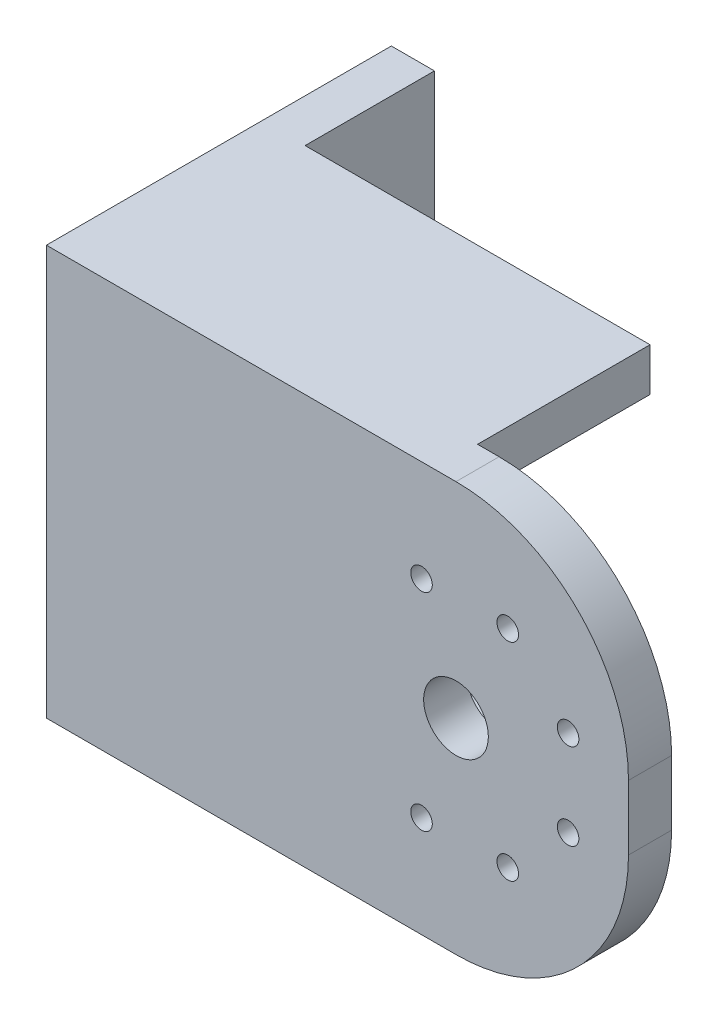
from build123d import *

# Parameters (mm, degrees)
SKETCH3_R           = 7.5
SKETCH3_R_2         = 2.5
BOSS_EXTRUDE1_DEPTH = 10
SKETCH4_W           = 10
SKETCH4_H           = 95
BOSS_EXTRUDE2_DEPTH = 70
SKETCH5_W           = 80
SKETCH5_H           = 10
BOSS_EXTRUDE3_DEPTH = 40
SKETCH6_W           = 32
SKETCH6_H           = 36
CUT_EXTRUDE1_DEPTH  = 43.8
SKETCH8_R           = 7.5
SKETCH8_R_2         = 2.5
CUT_EXTRUDE2_DEPTH  = 43.8
FILLET3_R           = 3


with BuildPart() as part:
    # Sketch3 → Boss-Extrude1 (new body)
    with BuildSketch(Plane.XY):
        with BuildLine():
            Line((68.617133813, 80.05993294), (163.617133813, 80.05993294))
            ThreePointArc((163.617133813, 80.05993294), (191.90140506, 68.344204188), (203.617133813, 40.05993294))
            Line((203.617133813, 40.05993294), (203.617133813, 25.05993294))
            ThreePointArc((203.617133813, 25.05993294), (191.90140506, -3.224338307), (163.617133813, -14.94006706))
            Line((163.617133813, -14.94006706), (68.617133813, -14.94006706))
            Line((68.617133813, -14.94006706), (68.617133813, 80.05993294))
        make_face()
        with Locations((163.617133813, 32.55993294)):
            Circle(SKETCH3_R, mode=Mode.SUBTRACT)
        with Locations((189.617133813, 42.55993294)):
            Circle(SKETCH3_R_2, mode=Mode.SUBTRACT)
        with Locations((155.617133813, 56.55993294)):
            Circle(SKETCH3_R_2, mode=Mode.SUBTRACT)
        with Locations((175.617133813, 56.55993294)):
            Circle(SKETCH3_R_2, mode=Mode.SUBTRACT)
        with Locations((155.617133813, 8.55993294)):
            Circle(SKETCH3_R_2, mode=Mode.SUBTRACT)
        with Locations((175.617133813, 8.55993294)):
            Circle(SKETCH3_R_2, mode=Mode.SUBTRACT)
        with Locations((189.617133813, 22.55993294)):
            Circle(SKETCH3_R_2, mode=Mode.SUBTRACT)
    extrude(amount=BOSS_EXTRUDE1_DEPTH)

    # Sketch4 → Boss-Extrude2 (add)
    with BuildSketch(Plane(origin=(0, 0, 0), x_dir=(-1, 0, 0), z_dir=(0, 0, -1))):
        with Locations((-73.617133813, 32.55993294)):
            Rectangle(SKETCH4_W, SKETCH4_H)
    extrude(amount=BOSS_EXTRUDE2_DEPTH)

    # Sketch5 → Boss-Extrude3 (add)
    with BuildSketch(Plane(origin=(0, 0, 0), x_dir=(-1, 0, 0), z_dir=(0, 0, -1))):
        with Locations((-118.617133813, 75.05993294)):
            Rectangle(SKETCH5_W, SKETCH5_H)
        with Locations((-118.617133813, -9.94006706)):
            Rectangle(SKETCH5_W, SKETCH5_H)
    extrude(amount=BOSS_EXTRUDE3_DEPTH)

    # Sketch6 → Cut-Extrude1 (cut)
    with BuildSketch(Plane.XZ.offset(14.94006706)):
        with Locations((104.617133813, -18)):
            Rectangle(SKETCH6_W, SKETCH6_H)
    extrude(amount=-CUT_EXTRUDE1_DEPTH, mode=Mode.SUBTRACT)

    # Sketch8 → Cut-Extrude2 (cut)
    with BuildSketch(Plane.ZY.offset(-68.617133813)):
        with Locations((-40, 32.55993294)):
            Circle(SKETCH8_R)
        with Locations((-56.167891819, 25.862972874)):
            Circle(SKETCH8_R_2)
        with Locations((-56.167891819, 39.256893006)):
            Circle(SKETCH8_R_2)
        with Locations((-46.696960066, 48.727824759)):
            Circle(SKETCH8_R_2)
        with Locations((-33.303039934, 48.727824759)):
            Circle(SKETCH8_R_2)
        with Locations((-23.832108181, 39.256893006)):
            Circle(SKETCH8_R_2)
        with Locations((-23.832108181, 25.862972874)):
            Circle(SKETCH8_R_2)
        with Locations((-33.303039934, 16.392041121)):
            Circle(SKETCH8_R_2)
        with Locations((-46.696960066, 16.392041121)):
            Circle(SKETCH8_R_2)
    extrude(amount=-CUT_EXTRUDE2_DEPTH, mode=Mode.SUBTRACT)

    # Fillet3
    fillet3_edges = [part.edges().sort_by_distance(p)[0] for p in [
        (120.617133813, -4.94006706, -18),
        (120.617133813, -14.94006706, -18),
        (88.617133813, -14.94006706, -18),
        (88.617133813, -4.94006706, -18),
        (104.617133813, -14.94006706, 0),
    ]]
    fillet(fillet3_edges, radius=FILLET3_R)


solid = part.part
